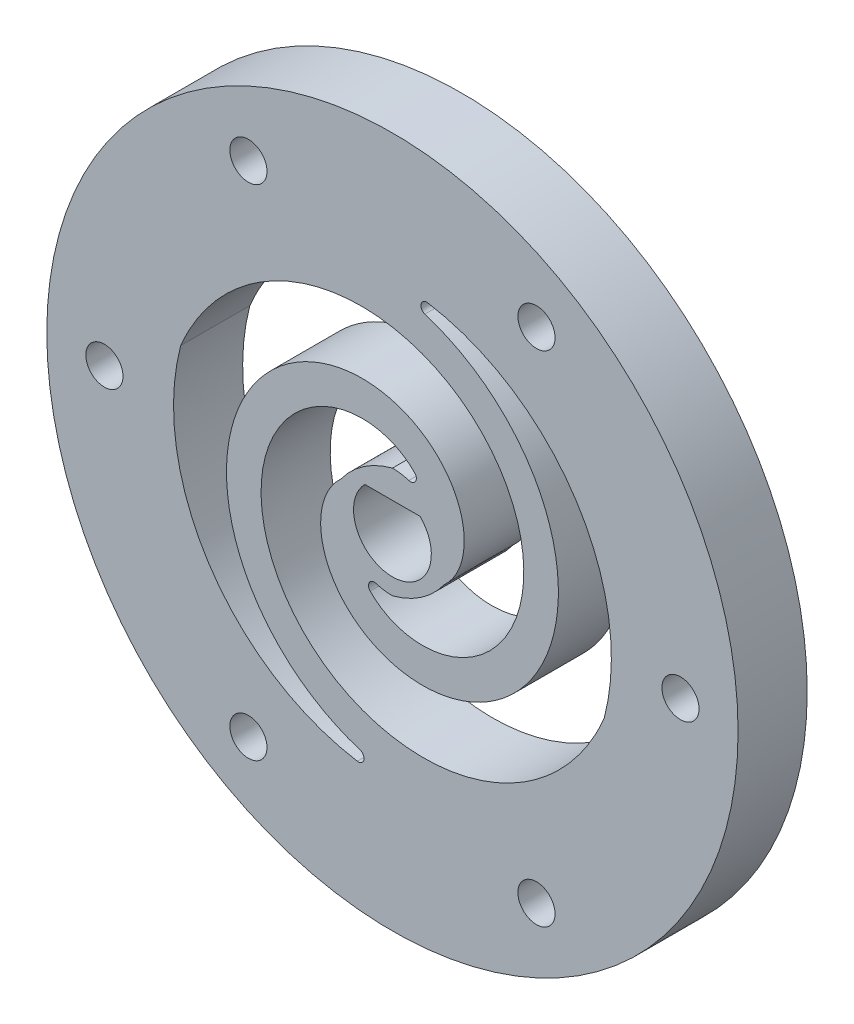
from build123d import *

# Parameters (mm, degrees)
SKETCH1_R               = 30
SKETCH1_R_2             = 19
BOSS_EXTRUDE1_DEPTH     = 6
SKETCH1_R_3             = 4.8
BOSS_EXTRUDE1_2_DEPTH   = 6
EXTRUDE_THIN1_DEPTH     = 6
CIRPATTERN1_COUNT       = 2
SKETCH9_R               = 4.086461839
BOSS_EXTRUDE3_DEPTH     = 2.5
CUT_EXTRUDE2_REACH      = 44.849
SKETCH4_R               = 1.6125
CIRPATTERN2_COUNT       = 6
CUT_EXTRUDE3_DEPTH      = 43.848570725
CUT_EXTRUDE3_DEPTH_BACK = 43.848570725
CUT_EXTRUDE4_REACH      = 44.849
FILLET3_R               = 0.5


# Read off the part's stored shape, not the designer's step: Extrude-Thin1
with BuildPart() as part:
    # Sketch1 → Boss-Extrude1 (new body)
    with BuildSketch(Plane.XY):
        Circle(SKETCH1_R)
        Circle(SKETCH1_R_2, mode=Mode.SUBTRACT)
    extrude(amount=BOSS_EXTRUDE1_DEPTH)



with BuildPart() as body_2:
    # Sketch1 → Boss-Extrude1 2 (new body)
    with BuildSketch(Plane.XY):
        Circle(SKETCH1_R_3)
    extrude(amount=BOSS_EXTRUDE1_2_DEPTH)


with BuildPart() as part_1:
    add(part.part)

    add(body_2.part)  # Extrude-Thin1 merges body 2
    # Extrude-Thin1 outline → Extrude-Thin1 (add)
    with BuildSketch(Plane.XY):
        with BuildLine():
            ThreePointArc((-2.982283939, -3.76111453), (-4.633404211, -1.253620924), (-4.471841365, 1.744314996))
            add(Edge.make_bspline(
                [(-4.471841365, 1.744314996), (-4.656280132, 1.578520884), (-4.829643815, 1.39644694), (-5.268134024, 0.859774522), (-5.508550979, 0.475921884), (-6.089314004, -0.796416981), (-6.277652461, -1.775043044), (-6.156958422, -3.849228134), (-5.848111539, -4.916888286), (-4.701074788, -6.924579158), (-3.874352285, -7.841881846), (-1.772209934, -9.303379732), (-0.515534208, -9.833026737), (2.2585228, -10.322842004), (3.754003283, -10.277922339), (6.737860458, -9.516399172), (8.205073527, -8.803982666), (10.830706996, -6.729759977), (11.973176133, -5.377828677), (13.242651036, -2.985752228), (13.590862634, -2.130587863), (14.11230257, -0.33141552), (14.284853693, 0.610384541), (14.434244224, 2.54590596), (14.410872075, 3.537351035), (14.155614086, 5.530618766), (13.92398055, 6.530190205), (13.24831887, 8.495265), (12.804987465, 9.458632364), (11.711589511, 11.305878718), (11.062628134, 12.187820678), (9.57337189, 13.827874293), (8.734539676, 14.584322286), (6.890445718, 15.932212548), (5.886940321, 16.522327046), (3.747220053, 17.501569877), (2.612981166, 17.889754848), (0.253213214, 18.436226952), (-0.970201662, 18.593988054), (-2.775234189, 18.641394623), (-3.338985958, 18.630807023), (-3.904551177, 18.594474451)],
                knots=[0.013114223, 0.013114223, 0.013114223, 0.013114223, 0.03125, 0.03125, 0.0625, 0.0625, 0.125, 0.125, 0.1875, 0.1875, 0.25, 0.25, 0.3125, 0.3125, 0.375, 0.375, 0.4375, 0.4375, 0.5, 0.5, 0.53125, 0.53125, 0.5625, 0.5625, 0.59375, 0.59375, 0.625, 0.625, 0.65625, 0.65625, 0.6875, 0.6875, 0.71875, 0.71875, 0.75, 0.75, 0.78125, 0.78125, 0.8125, 0.8125, 0.826547707, 0.826547707, 0.826547707, 0.826547707], degree=3))
            ThreePointArc((-3.904551177, 18.594474451), (-13.097935775, 13.763868585), (-18.378155197, 4.821142141))
            add(Edge.make_bspline(
                [(-2.982283939, -3.76111453), (-2.900117375, -3.985308214), (-2.796401924, -4.21083352), (-2.324302177, -5.037163062), (-1.796089022, -5.632977998), (-0.42544773, -6.585905543), (0.434939841, -6.954445423), (2.351330437, -7.292822525), (3.427095408, -7.265193511), (5.581040851, -6.715475726), (6.677239672, -6.187769457), (8.63917944, -4.637857777), (9.517283547, -3.605835215), (10.495671123, -1.762255736), (10.766831426, -1.097457986), (11.173484801, 0.30565569), (11.309561474, 1.046104982), (11.427328915, 2.571913894), (11.409154422, 3.359454964), (11.205932916, 4.946378335), (11.020577877, 5.747900562), (10.477750396, 7.326644233), (10.119550016, 8.105878633), (9.233725774, 9.602438596), (8.704992436, 10.321571812), (7.489073995, 11.660610304), (6.800450018, 12.282049392), (5.283951031, 13.39049303), (4.454371448, 13.878701098), (2.6829423, 14.689395523), (1.739195133, 15.012712578), (-0.226650012, 15.467960532), (-1.25075985, 15.600322026), (-3.337683593, 15.655132061), (-4.402541801, 15.577599807), (-6.527123675, 15.202481181), (-7.588842349, 14.904507495), (-9.660915862, 14.087662981), (-10.673137841, 13.568018908), (-12.599590732, 12.316810654), (-13.515488441, 11.58412259), (-15.204366904, 9.925715954), (-15.9787504, 8.998571318), (-17.325389887, 7.006470862), (-17.903482072, 5.944264002), (-18.378155197, 4.821142141)],
                knots=[0.164583944, 0.164583944, 0.164583944, 0.164583944, 0.1875, 0.1875, 0.25, 0.25, 0.3125, 0.3125, 0.375, 0.375, 0.4375, 0.4375, 0.5, 0.5, 0.53125, 0.53125, 0.5625, 0.5625, 0.59375, 0.59375, 0.625, 0.625, 0.65625, 0.65625, 0.6875, 0.6875, 0.71875, 0.71875, 0.75, 0.75, 0.78125, 0.78125, 0.8125, 0.8125, 0.84375, 0.84375, 0.875, 0.875, 0.90625, 0.90625, 0.9375, 0.9375, 0.96875, 0.96875, 0.999171124, 0.999171124, 0.999171124, 0.999171124], degree=3))
        make_face()
    extrude_thin1 = extrude(amount=EXTRUDE_THIN1_DEPTH)

    # CirPattern1: Extrude-Thin1 ×2 about axis
    cirpattern1_axis = Axis((0, 0, 6), (0, 0, -1))
    for i in range(1, CIRPATTERN1_COUNT):
        add(extrude_thin1.rotate(cirpattern1_axis, i * 360 / CIRPATTERN1_COUNT))

    # Sketch9 → Boss-Extrude3 (add)
    with BuildSketch(Plane(origin=(0, 0, 0), x_dir=(-1, 0, 0), z_dir=(0, 0, -1))):
        with Locations(Location((0, 0, 0), (0, 0, 180))):
            Circle(SKETCH9_R)
    extrude(amount=BOSS_EXTRUDE3_DEPTH)

    # Sketch4 → Cut-Extrude2 (cut, up to next)
    with BuildSketch(Plane.XY, mode=Mode.PRIVATE) as cut_extrude2_sk1:
        with Locations(Location((-25, 0, 0), (0, 0, 180))):
            Circle(SKETCH4_R)
    cut_extrude2_tool1 = extrude(cut_extrude2_sk1.sketch, amount=CUT_EXTRUDE2_REACH, mode=Mode.PRIVATE) & part_1.part
    cut_extrude2 = cut_extrude2_tool1.solids().sort_by_distance((-25, 0, 0))[0]
    add(cut_extrude2, mode=Mode.SUBTRACT)

    # CirPattern2: Cut-Extrude2 ×6 about axis
    cirpattern2_axis = Axis((0, 0, 0), (0, 0, 1))
    for i in range(1, CIRPATTERN2_COUNT):
        add(cut_extrude2.rotate(cirpattern2_axis, i * 360 / CIRPATTERN2_COUNT), mode=Mode.SUBTRACT)

    # Sketch6 → Cut-Extrude3 (cut, two sides: drawn at the far end of the back side and taken through both)
    with BuildSketch(Plane.XY.offset(-CUT_EXTRUDE3_DEPTH_BACK)):
        with BuildLine():
            Line((-2.397915762, 2.375), (2.397915762, 2.375))
            ThreePointArc((2.397915762, 2.375), (0, -3.375), (-2.397915762, 2.375))
        make_face()
    extrude(amount=CUT_EXTRUDE3_DEPTH + CUT_EXTRUDE3_DEPTH_BACK, mode=Mode.SUBTRACT)

    # Sketch7 → Cut-Extrude4 (cut, up to next)
    with BuildSketch(Plane.XY, mode=Mode.PRIVATE) as cut_extrude4_sk1:
        with BuildLine():
            ThreePointArc((-4.471841365, 1.744314996), (-2.708070163, 3.963124524), (0, 4.8))
            ThreePointArc((0, 4.8), (-2.503483375, 3.663722045), (-4.471841365, 1.744314996))
        make_face()
    cut_extrude4_tool1 = extrude(cut_extrude4_sk1.sketch, amount=CUT_EXTRUDE4_REACH, mode=Mode.PRIVATE) & part_1.part
    # Sketch7 → Cut-Extrude4 (cut, up to next)
    with BuildSketch(Plane.XY, mode=Mode.PRIVATE) as cut_extrude4_sk2:
        with BuildLine():
            ThreePointArc((4.471841365, -1.744314996), (2.708070163, -3.963124524), (0, -4.8))
            ThreePointArc((0, -4.8), (2.503483375, -3.663722045), (4.471841365, -1.744314996))
        make_face()
    cut_extrude4_tool2 = extrude(cut_extrude4_sk2.sketch, amount=CUT_EXTRUDE4_REACH, mode=Mode.PRIVATE) & part_1.part
    add(cut_extrude4_tool1.solids().sort_by_distance((-2.531789, 3.705146, 0))[0], mode=Mode.SUBTRACT)
    add(cut_extrude4_tool2.solids().sort_by_distance((2.531789, -3.705146, 0))[0], mode=Mode.SUBTRACT)

    # Fillet3
    fillet3_edges = [part_1.edges().sort_by_distance(p)[0] for p in [
        (-3.904551177, 18.594474451, 3),
        (-2.982283939, -3.76111453, 3),
        (2.982283939, 3.76111453, 3),
        (3.904551177, -18.594474451, 3),
    ]]
    fillet(fillet3_edges, radius=FILLET3_R)


solid = part_1.part
